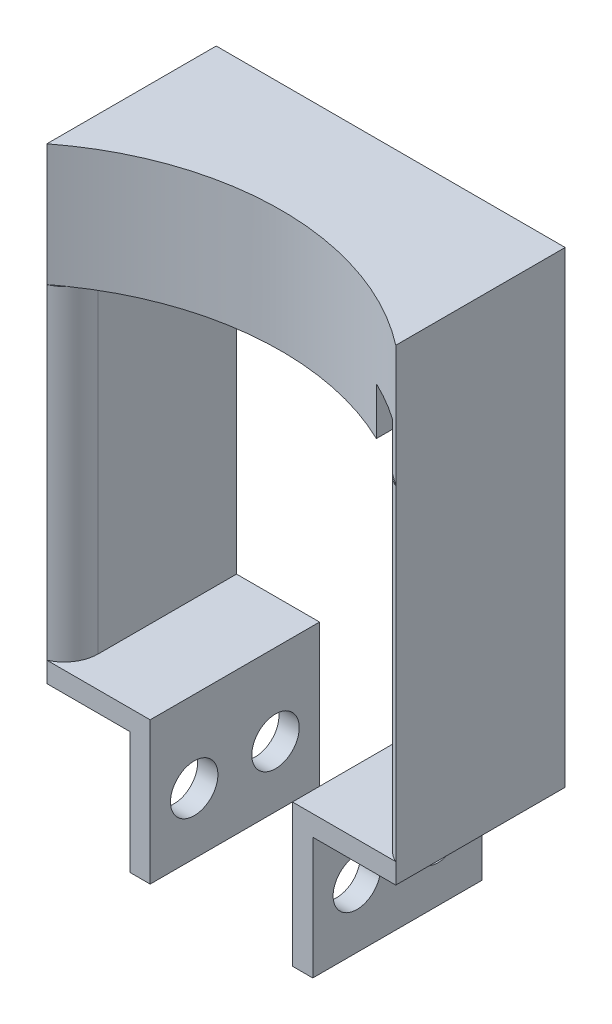
from build123d import *

# Parameters (mm, degrees)
BOSS_EXTRUDE1_DEPTH = 25
SKETCH2_R           = 3.5
CUT_EXTRUDE1_DEPTH  = 65.734554142
CUT_EXTRUDE3_REACH  = 96.752
FILLET1_R           = 5


with BuildPart() as part:
    # Sketch1 → Boss-Extrude1 (new body)
    with BuildSketch(Plane.XY):
        Polygon((-20.5, 24), (20.5, 24), (20.5, 31), (25, 31), (25, -24), (12.75, -24), (12.75, -45), (15.75, -45), (15.75, -27), (28, -27), (28, 34), (28, 42), (-23.5, 42), (-23.5, 27), (-23.5, -27), (-11.25, -27), (-11.25, -45), (-8.25, -45), (-8.25, -24), (-20.5, -24), align=None)
    extrude(amount=BOSS_EXTRUDE1_DEPTH)

    # Sketch2 → Cut-Extrude1 (cut, through all)
    with BuildSketch(Plane(origin=(-11.25, 0, 0), x_dir=(0, 0, -1), z_dir=(1, 0, 0))):
        with Locations(Location((-6.5, -36, 0), (0, 0, 270))):
            Circle(SKETCH2_R)
        with Locations(Location((-18.5, -36, 0), (0, 0, 180))):
            Circle(SKETCH2_R)
    extrude(amount=CUT_EXTRUDE1_DEPTH, mode=Mode.SUBTRACT)

    # Cut-Extrude3: up to this face of the body (flat: up to its plane)
    cut_extrude3_end = Plane(part.part.faces().sort_by_distance((0, 24, 12.5))[0])
    # Sketch4 → Cut-Extrude3 (cut, up to the picked face)
    with BuildSketch(Plane(origin=(0, 42, 0), x_dir=(1, 0, 0), z_dir=(0, 1, 0)), mode=Mode.PRIVATE) as cut_extrude3_sk1:
        with BuildLine():
            Line((28, -25), (-23.5, -25))
            ThreePointArc((-23.5, -25), (2.25, -16.180378238), (28, -25))
        make_face()
    cut_extrude3_tool1 = split(extrude(cut_extrude3_sk1.sketch, amount=-CUT_EXTRUDE3_REACH, mode=Mode.PRIVATE), bisect_by=cut_extrude3_end, keep=Keep.BOTH, mode=Mode.PRIVATE)
    add(cut_extrude3_tool1.solids().sort_by(Axis((2.25, 42, 21.438341), (0, -1, 0)))[0], mode=Mode.SUBTRACT)

    # Fillet1
    # the kernel refuses this fillet: 5 mm, written as the material it takes off along each edge
    with BuildSketch(Plane(origin=(25, 35.456439237, 25), x_dir=(0, 0, -1), z_dir=(0, -1, 0))) as fillet1_piece_1_section:
        with BuildLine():
            CenterArc((4.582575695, 5), FILLET1_R, 203.578178478, 66.421821522)
            Line((0, 3), (0, 0))
            Line((0, 0), (4.582575695, 0))
        make_face()
    fillet1_piece_1 = extrude(amount=59.456439237, mode=Mode.PRIVATE)
    fillet1_piece_1 = split(fillet1_piece_1, bisect_by=Plane(origin=(25.306626157, 31, 22.170234041), z_dir=(0, -1, 0)), keep=Keep.TOP, mode=Mode.PRIVATE)
    add(fillet1_piece_1, mode=Mode.SUBTRACT)
    with BuildSketch(Plane(origin=(-20.5, -24, 25), x_dir=(0, 0, -1), z_dir=(0, 1, 0))) as fillet1_piece_2:
        with BuildLine():
            CenterArc((4.582575695, 5), FILLET1_R, 203.578178478, 66.421821522)
            Line((0, 3), (0, 0))
            Line((0, 0), (4.582575695, 0))
        make_face()
    extrude(amount=48, mode=Mode.SUBTRACT)


solid = part.part
